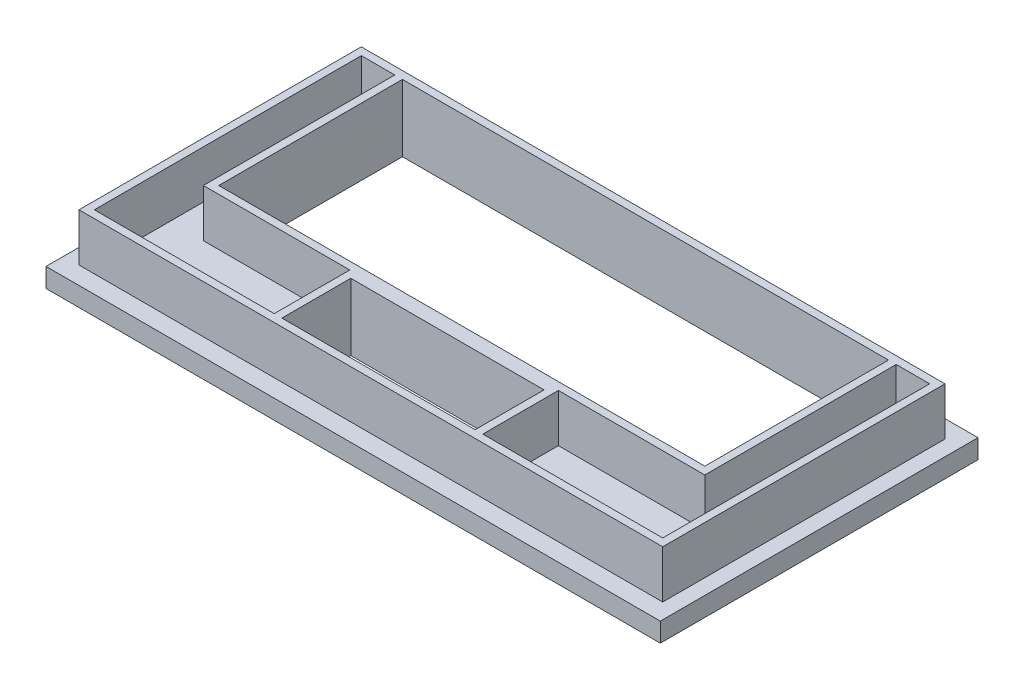
from build123d import *

# Parameters (mm, degrees)
SKETCH_1_W          = 64.2
SKETCH_1_H          = 33.2
EXTRUDE_1_DEPTH     = 2
SKETCH_2_W          = 61
SKETCH_2_H          = 29.5
SKETCH_2_W_2        = 59.4
SKETCH_2_H_2        = 27.9
EXTRUDE_2_DEPTH     = 5
OTHER_START         = -13.95
OTHER_1_OUTLINE_W   = 50.8
OTHER_1_OUTLINE_H   = 2
OTHER_1_DEPTH       = 19.2
OTHER_START_2       = 6.75
OTHER_1_2_OUTLINE_W = 20.2
OTHER_1_2_OUTLINE_H = 2
OTHER_1_2_DEPTH     = 7.2
EXTRUDE_6_DEPTH     = 5


# Read off the part's stored shape, not the designer's step: Полость1
with BuildPart() as part:
    # Эскиз1 → Бобышка-Вытянуть1 (new body)
    with BuildSketch(Plane(origin=(0, 0, 0), x_dir=(1, 0, 0), z_dir=(0, 1, 0))):
        Rectangle(SKETCH_1_W, SKETCH_1_H)
    extrude(amount=EXTRUDE_1_DEPTH)

    # Эскиз2 → Бобышка-Вытянуть2 (add)
    with BuildSketch(Plane(origin=(0, 2, 0), x_dir=(1, 0, 0), z_dir=(0, 1, 0))):
        Rectangle(SKETCH_2_W, SKETCH_2_H)
        Rectangle(SKETCH_2_W_2, SKETCH_2_H_2, mode=Mode.SUBTRACT)
    extrude(amount=EXTRUDE_2_DEPTH)

    # Полость1 outline → Полость1 (cut)
    with BuildSketch(Plane.XY.offset(OTHER_START)):
        with Locations((0, 1)):
            Rectangle(OTHER_1_OUTLINE_W, OTHER_1_OUTLINE_H)
    extrude(amount=OTHER_1_DEPTH, mode=Mode.SUBTRACT)

    # Other 1 2 outline → Other 1 2 (cut)
    with BuildSketch(Plane.XY.offset(OTHER_START_2)):
        with Locations((0, 1)):
            Rectangle(OTHER_1_2_OUTLINE_W, OTHER_1_2_OUTLINE_H)
    extrude(amount=OTHER_1_2_DEPTH, mode=Mode.SUBTRACT)

    # Эскиз8 → Бобышка-Вытянуть6 (add)
    with BuildSketch(Plane(origin=(0, 2, 0), x_dir=(1, 0, 0), z_dir=(0, 1, 0))):
        Polygon((-26.2, 13.95), (-26.2, -6.05), (-10.9, -6.05), (-10.9, -13.95), (-10.1, -13.95), (-10.1, -6.75), (10.1, -6.75), (10.1, -13.95), (10.9, -13.95), (10.9, -6.05), (26.2, -6.05), (26.2, 13.95), (25.4, 13.95), (25.4, -5.25), (-25.4, -5.25), (-25.4, 13.95), align=None)
    extrude(amount=EXTRUDE_6_DEPTH)


solid = part.part
